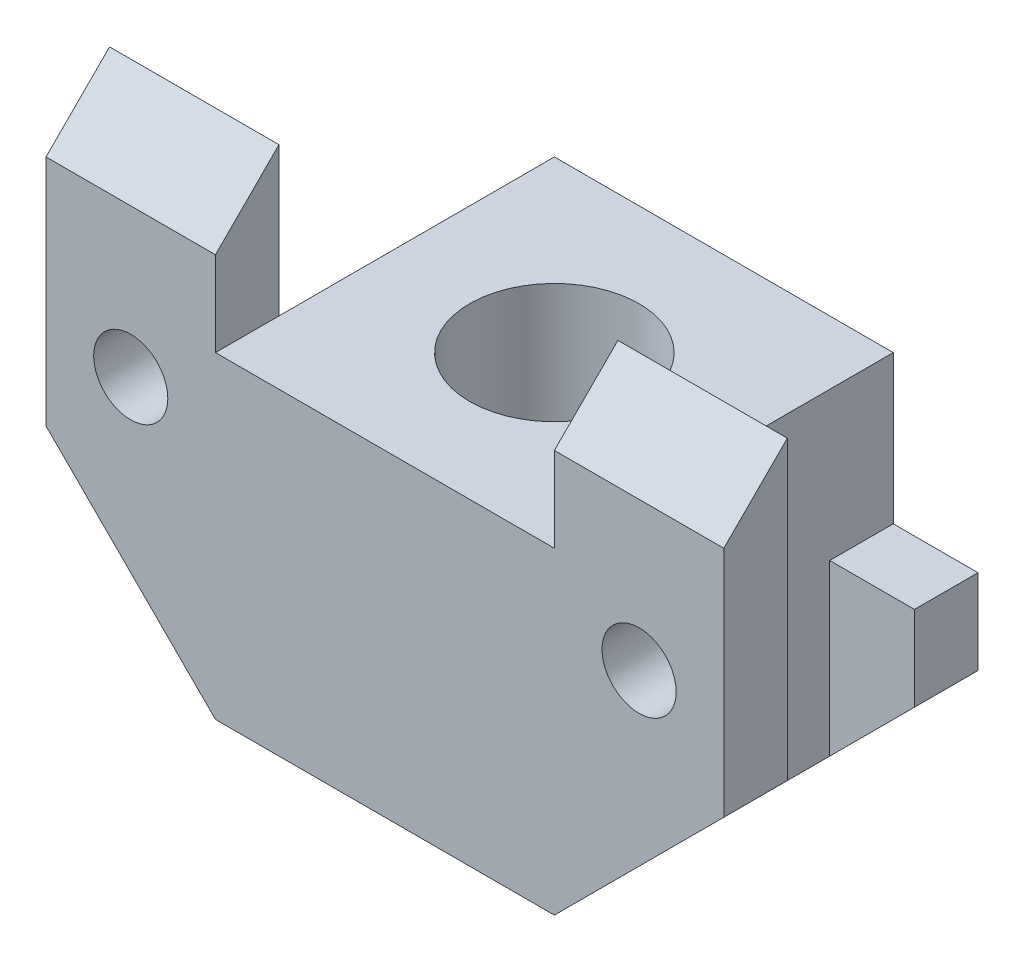
from build123d import *

# Parameters (mm, degrees)
SKETCH1_R                      = 4
BOSS_EXTRUDE1_DEPTH            = 15
CHAMFER1_SIZE                  = 8
SKETCH2_W                      = 8
SKETCH2_H                      = 3
BOSS_EXTRUDE2_DEPTH            = 7
CHAMFER3_SIZE                  = 3
SKETCH4_W                      = 32
SKETCH4_H                      = 3
CUT_EXTRUDE2_DEPTH             = 7
CUT_EXTRUDE2_DIRECTION_2_REACH = 25.345
CUT_EXTRUDE3_REACH             = 33.559
SKETCH6_R                      = 1.75
CUT_EXTRUDE4_DEPTH             = 32.559467676
SKETCH7_W                      = 16
SKETCH7_H                      = 3
BOSS_EXTRUDE3_DEPTH            = 7


with BuildPart() as part:
    # Sketch1 → Boss-Extrude1 (new body)
    with BuildSketch(Plane(origin=(0, 0, 0), x_dir=(1, 0, 0), z_dir=(0, 1, 0))):
        Polygon((-8, -5), (-8, 5), (-16, 5), (-16, 8), (16, 8), (16, 5), (8, 5), (8, -5), (16, -5), (16, -8), (-16, -8), (-16, -5), align=None)
        with Locations(Location((0, 0, 0), (0, 0, 270))):
            Circle(SKETCH1_R, mode=Mode.SUBTRACT)
    extrude(amount=BOSS_EXTRUDE1_DEPTH)

    # Chamfer1
    chamfer1_edges = [part.edges().sort_by_distance(p)[0] for p in [
        (16, 0, 6.5),
        (-16, 0, 6.5),
        (-16, 0, -6.5),
        (16, 0, -6.5),
    ]]
    chamfer(chamfer1_edges, length=CHAMFER1_SIZE)

    # Sketch2 → Boss-Extrude2 (add)
    with BuildSketch(Plane(origin=(0, 15, 0), x_dir=(1, 0, 0), z_dir=(0, 1, 0))):
        with Locations((12, -6.5)):
            Rectangle(SKETCH2_W, SKETCH2_H)
        with Locations((12, 6.5)):
            Rectangle(SKETCH2_W, SKETCH2_H)
        with Locations((-12, -6.5)):
            Rectangle(SKETCH2_W, SKETCH2_H)
        with Locations((-12, 6.5)):
            Rectangle(SKETCH2_W, SKETCH2_H)
    extrude(amount=BOSS_EXTRUDE2_DEPTH)

    # Chamfer3
    chamfer3_edges = [part.edges().sort_by_distance(p)[0] for p in [
        (-12, 22, 8),
        (12, 22, 8),
        (-12, 22, -8),
        (12, 22, -8),
    ]]
    chamfer(chamfer3_edges, length=CHAMFER3_SIZE - 0.0001)  # a hair under: the kernel refuses the full size

    # Sketch4 → Cut-Extrude2 (cut)
    with BuildSketch(Plane(origin=(0, 15, 0), x_dir=(1, 0, 0), z_dir=(0, 1, 0))):
        with Locations((0, 6.5)):
            Rectangle(SKETCH4_W, SKETCH4_H)
    extrude(amount=-CUT_EXTRUDE2_DEPTH, mode=Mode.SUBTRACT)

    # Sketch4 → Cut-Extrude2 direction 2 (cut, up to next)
    with BuildSketch(Plane(origin=(0, 15, 0), x_dir=(1, 0, 0), z_dir=(0, 1, 0)), mode=Mode.PRIVATE) as cut_extrude2_direction_2_sk1:
        with Locations((0, 6.5)):
            Rectangle(SKETCH4_W, SKETCH4_H)
    cut_extrude2_direction_2_tool1 = extrude(cut_extrude2_direction_2_sk1.sketch, amount=CUT_EXTRUDE2_DIRECTION_2_REACH, mode=Mode.PRIVATE) & part.part
    add(cut_extrude2_direction_2_tool1.solids().sort_by_distance((0, 15, -6.5))[0], mode=Mode.SUBTRACT)


with BuildPart() as cut_extrude2_kept_piece:
    # of the separate pieces the step leaves, the one the design keeps (cut_extrude2_pieces_kept)
    add(part.part.solids().sort_by_distance((-16, 8, -5))[0])

    # Sketch5 → Cut-Extrude3 (cut, up to next)
    with BuildSketch(Plane(origin=(0, 0, -8), x_dir=(-1, 0, 0), z_dir=(0, 0, -1)), mode=Mode.PRIVATE) as cut_extrude3_sk1:
        Polygon((-12, 4), (-12, 8), (-16, 8), align=None)
    cut_extrude3_tool1 = extrude(cut_extrude3_sk1.sketch, amount=-CUT_EXTRUDE3_REACH, mode=Mode.PRIVATE) & cut_extrude2_kept_piece.part
    # Sketch5 → Cut-Extrude3 (cut, up to next)
    with BuildSketch(Plane(origin=(0, 0, -8), x_dir=(-1, 0, 0), z_dir=(0, 0, -1)), mode=Mode.PRIVATE) as cut_extrude3_sk2:
        Polygon((16, 8), (12, 4), (12, 8), align=None)
    cut_extrude3_tool2 = extrude(cut_extrude3_sk2.sketch, amount=-CUT_EXTRUDE3_REACH, mode=Mode.PRIVATE) & cut_extrude2_kept_piece.part
    add(cut_extrude3_tool1.solids().sort_by_distance((13.333333, 6.666667, -8))[0], mode=Mode.SUBTRACT)
    add(cut_extrude3_tool2.solids().sort_by_distance((-13.333333, 6.666667, -8))[0], mode=Mode.SUBTRACT)

    # Sketch6 → Cut-Extrude4 (cut, through all)
    with BuildSketch(Plane.XY.offset(8)):
        with Locations((12, 12)):
            Circle(SKETCH6_R)
        with Locations((-12, 12)):
            Circle(SKETCH6_R)
    extrude(amount=-CUT_EXTRUDE4_DEPTH, mode=Mode.SUBTRACT)

    # Sketch7 → Boss-Extrude3 (add)
    with BuildSketch(Plane(origin=(0, 8, 0), x_dir=(1, 0, 0), z_dir=(0, 1, 0))):
        with Locations((0, 6.5)):
            Rectangle(SKETCH7_W, SKETCH7_H)
    extrude(amount=BOSS_EXTRUDE3_DEPTH)


solid = cut_extrude2_kept_piece.part
